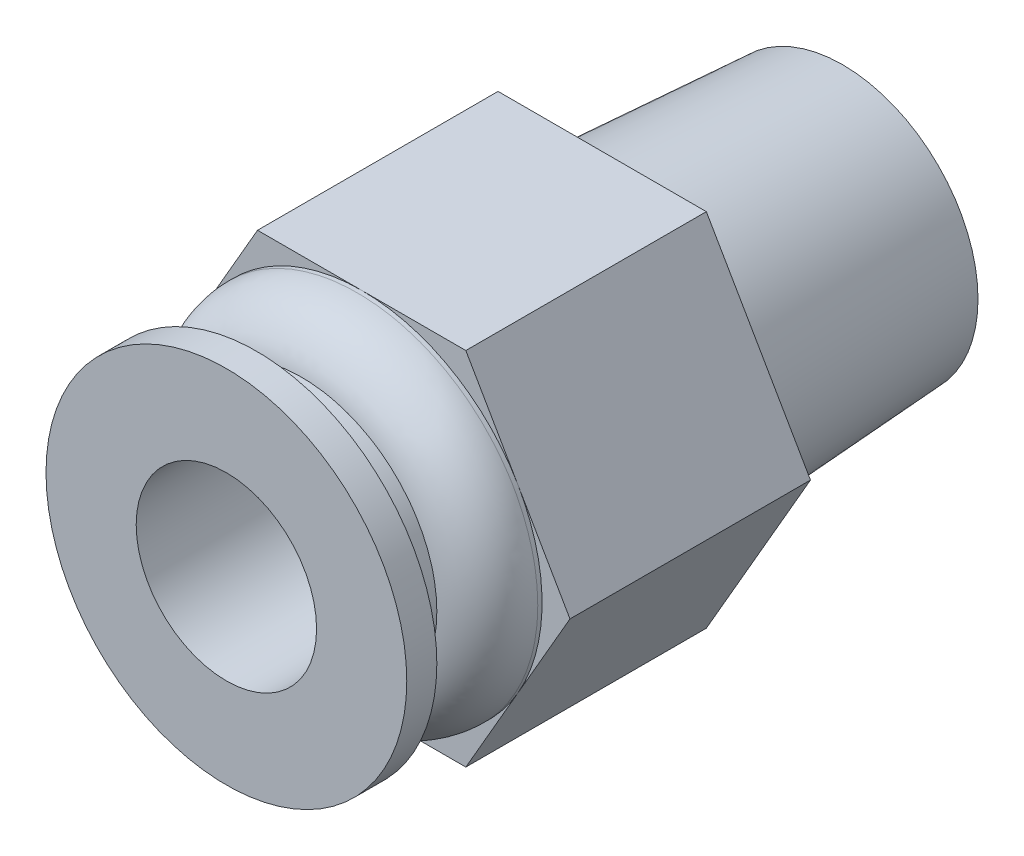
from build123d import *

# Parameters (mm, degrees)
SKETCH1_R           = 4.5
BOSS_EXTRUDE1_DEPTH = 8
BOSS_EXTRUDE1_DRAFT = -3.5
BOSS_EXTRUDE2_DEPTH = 8
SKETCH3_R           = 6
BOSS_EXTRUDE3_DEPTH = 2
SKETCH9_R           = 4.5
BOSS_EXTRUDE6_DEPTH = 0.5
FILLET1_R           = 1.9
SKETCH4_R           = 3.75
BOSS_EXTRUDE4_DEPTH = 1
SKETCH5_R           = 6
BOSS_EXTRUDE5_DEPTH = 1
SKETCH6_R           = 3
CUT_EXTRUDE1_DEPTH  = 8.5
CUT_EXTRUDE2_DEPTH  = 8
SKETCH8_R           = 3.175
CUT_EXTRUDE3_DEPTH  = 4


with BuildPart() as part:
    # Sketch1 → Boss-Extrude1 (with draft: the straight prism first)
    with BuildSketch(Plane.XY):
        Circle(SKETCH1_R)
    extrude(amount=BOSS_EXTRUDE1_DEPTH)
    # Boss-Extrude1: the draft: its side faces are tilted about the plane it starts from
    boss_extrude1_sides = [part.faces().sort_by_distance(p)[0] for p in [
        (-4.5, 0, 4),
    ]]
    draft(boss_extrude1_sides, Plane.XY, BOSS_EXTRUDE1_DRAFT)

    # Sketch2 → Boss-Extrude2 (add)
    with BuildSketch(Plane.XY.offset(8)):
        Polygon((6.92820323, 0), (3.464101615, 6), (-3.464101615, 6), (-6.92820323, 0), (-3.464101615, -6), (3.464101615, -6), align=None)
    extrude(amount=BOSS_EXTRUDE2_DEPTH)

    # Sketch3 → Boss-Extrude3 (add)
    with BuildSketch(Plane.XY.offset(16)):
        with Locations(Location((0, 0, 0), (0, 0, 150))):
            Circle(SKETCH3_R)
    extrude(amount=BOSS_EXTRUDE3_DEPTH)

    # Sketch9 → Boss-Extrude6 (add)
    with BuildSketch(Plane.XY.offset(18)):
        Circle(SKETCH9_R)
    extrude(amount=BOSS_EXTRUDE6_DEPTH)

    # Fillet1
    # the kernel refuses this fillet: 1.9 mm, written as the material it takes off along each edge
    with BuildSketch(Plane(origin=(0, 0, 18), x_dir=(-0.8660254037844387, 0.49999999999999994, 0), z_dir=(0.49999999999999994, 0.8660254037844387, 0))) as fillet1_piece_1:
        with BuildLine():
            CenterArc((4.1, -1.857417562), FILLET1_R, 0, 77.846802531)
            Line((4.5, 0), (4.508, 0.037148351))
            ThreePointArc((4.508, 0.037148351), (5.25, 0.038), (6, 0.038))
            Line((6, 0.038), (6.038, 0))
            Line((6.038, 0), (6.038, -1.857417562))
            Line((6.038, -1.857417562), (6, -1.857417562))
        make_face()
    revolve(axis=Axis((0, 0, 18), (0, 0, 1)), mode=Mode.SUBTRACT)

    # Sketch4 → Boss-Extrude4 (add)
    with BuildSketch(Plane.XY.offset(18.5)):
        Circle(SKETCH4_R)
    extrude(amount=BOSS_EXTRUDE4_DEPTH)

    # Sketch5 → Boss-Extrude5 (add)
    with BuildSketch(Plane.XY.offset(19.5)):
        with Locations(Location((0, 0, 0), (0, 0, 150))):
            Circle(SKETCH5_R)
    extrude(amount=BOSS_EXTRUDE5_DEPTH)

    # Sketch6 → Cut-Extrude1 (cut)
    with BuildSketch(Plane.XY.offset(20.5)):
        Circle(SKETCH6_R)
    extrude(amount=-CUT_EXTRUDE1_DEPTH, mode=Mode.SUBTRACT)

    # Sketch7 → Cut-Extrude2 (cut)
    with BuildSketch(Plane.XY.offset(12)):
        Polygon((0, -2.309401077), (2, -1.154700538), (2, 1.154700538), (0, 2.309401077), (-2, 1.154700538), (-2, -1.154700538), align=None)
    extrude(amount=-CUT_EXTRUDE2_DEPTH, mode=Mode.SUBTRACT)

    # Sketch8 → Cut-Extrude3 (cut)
    with BuildSketch(Plane(origin=(0, 0, 0), x_dir=(-1, 0, 0), z_dir=(0, 0, -1))):
        Circle(SKETCH8_R)
    extrude(amount=-CUT_EXTRUDE3_DEPTH, mode=Mode.SUBTRACT)


solid = part.part
